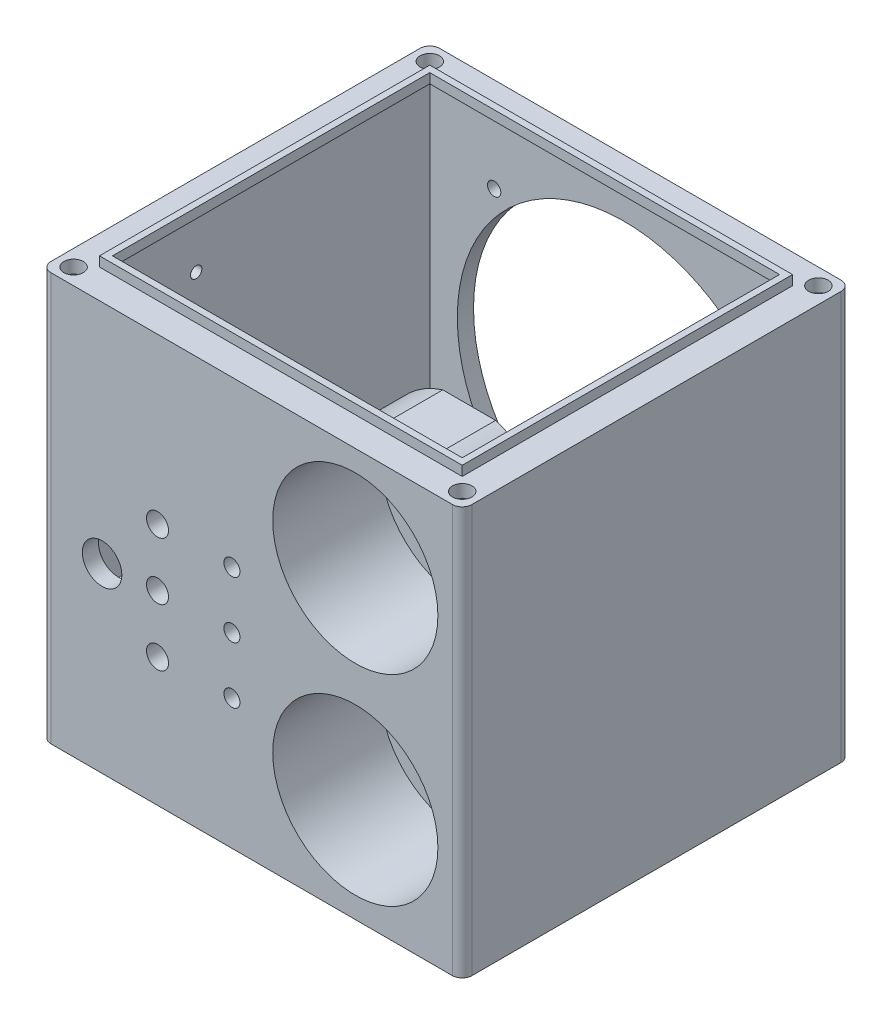
from build123d import *

# Parameters (mm, degrees)
SKETCH1_W           = 130
SKETCH1_H           = 126
BOSS_EXTRUDE1_DEPTH = 120
SKETCH3_W           = 120
SKETCH3_H           = 110
CUT_EXTRUDE3_DEPTH  = 121
SKETCH2_R           = 11
SKETCH2_R_2         = 3.55
SKETCH2_R_3         = 6.1
SKETCH2_R_4         = 3.4
SKETCH2_R_5         = 2.476
CUT_EXTRUDE4_DEPTH  = 5
SKETCH6_R           = 51.5
SKETCH6_R_2         = 2.05
CUT_EXTRUDE5_DEPTH  = 5
SKETCH7_W           = 120
SKETCH7_H           = 110
SKETCH7_W_2         = 108
SKETCH7_H_2         = 98
BOSS_EXTRUDE2_DEPTH = 6
SKETCH8_W           = 112
SKETCH8_H           = 102
SKETCH8_W_2         = 108
SKETCH8_H_2         = 98
BOSS_EXTRUDE3_DEPTH = 3
SKETCH9_R           = 3
CUT_EXTRUDE6_DEPTH  = 4
CHAMFER2_SIZE       = 6
SKETCH10_R          = 1.75
SKETCH10_W          = 32.45
SKETCH10_H          = 20.574
CUT_EXTRUDE10_DEPTH = 10
FILLET4_R           = 3
SKETCH16_R          = 25.5
CUT_EXTRUDE9_DEPTH  = 2
SKETCH18_R          = 27.25
SKETCH18_R_2        = 25.25
BOSS_EXTRUDE4_DEPTH = 28.16
SKETCH19_R          = 27.25
BOSS_EXTRUDE5_DEPTH = 2
SKETCH20_R          = 3.55
SKETCH20_R_2        = 11
CUT_EXTRUDE11_DEPTH = 51
SKETCH21_R          = 25.5
CUT_EXTRUDE12_DEPTH = 31.16


with BuildPart() as part:
    # Sketch1 → Boss-Extrude1 (new body)
    with BuildSketch(Plane.XY):
        Rectangle(SKETCH1_W, SKETCH1_H)
    extrude(amount=BOSS_EXTRUDE1_DEPTH)

    # Sketch3 → Cut-Extrude3 (cut)
    with BuildSketch(Plane(origin=(0, 63, 0), x_dir=(1, 0, 0), z_dir=(0, 1, 0))):
        with Locations((0, -60)):
            Rectangle(SKETCH3_W, SKETCH3_H)
    extrude(amount=-CUT_EXTRUDE3_DEPTH, mode=Mode.SUBTRACT)

    # Sketch2 → Cut-Extrude4 (cut)
    with BuildSketch(Plane.XY.offset(120)):
        with Locations((32, 31)):
            Circle(SKETCH2_R)
        with Locations((32, 49.7)):
            Circle(SKETCH2_R_2)
        with Locations((-46.2, -6.9)):
            Circle(SKETCH2_R_3)
        with Locations((-29.08, -5.56)):
            Circle(SKETCH2_R_4)
        with Locations((-29.08, 12.19)):
            Circle(SKETCH2_R_4)
        with Locations((-29.08, -23.31)):
            Circle(SKETCH2_R_4)
        with Locations((-6.1, -22.81)):
            Circle(SKETCH2_R_5)
        with Locations((-6.1, -5.31)):
            Circle(SKETCH2_R_5)
        with Locations((-6.1, 12.19)):
            Circle(SKETCH2_R_5)
        with Locations((32, -49.7)):
            Circle(SKETCH2_R_2)
        with Locations((32, 12.3)):
            Circle(SKETCH2_R_2)
        with Locations((32, -31)):
            Circle(SKETCH2_R)
        with Locations((32, -12.3)):
            Circle(SKETCH2_R_2)
    extrude(amount=-CUT_EXTRUDE4_DEPTH, mode=Mode.SUBTRACT)

    # Sketch6 → Cut-Extrude5 (cut)
    with BuildSketch(Plane(origin=(0, 0, 0), x_dir=(-1, 0, 0), z_dir=(0, 0, -1))):
        with Locations((0, -1.25)):
            Circle(SKETCH6_R)
        with Locations((40.128309832, -41.378309832)):
            Circle(SKETCH6_R_2)
        with Locations((-40.128309832, -41.378309832)):
            Circle(SKETCH6_R_2)
        with Locations((40.128309832, 38.878309832)):
            Circle(SKETCH6_R_2)
        with Locations((-40.128309832, 38.878309832)):
            Circle(SKETCH6_R_2)
    extrude(amount=-CUT_EXTRUDE5_DEPTH, mode=Mode.SUBTRACT)

    # Sketch7 → Boss-Extrude2 (add)
    with BuildSketch(Plane(origin=(0, 63, 0), x_dir=(1, 0, 0), z_dir=(0, 1, 0))):
        with Locations((0, -60)):
            Rectangle(SKETCH7_W, SKETCH7_H)
        with Locations((0, -60)):
            Rectangle(SKETCH7_W_2, SKETCH7_H_2, mode=Mode.SUBTRACT)
    extrude(amount=-BOSS_EXTRUDE2_DEPTH)

    # Sketch8 → Boss-Extrude3 (add)
    with BuildSketch(Plane(origin=(0, 63, 0), x_dir=(1, 0, 0), z_dir=(0, 1, 0))):
        with Locations((0, -60)):
            Rectangle(SKETCH8_W, SKETCH8_H)
        with Locations((0, -60)):
            Rectangle(SKETCH8_W_2, SKETCH8_H_2, mode=Mode.SUBTRACT)
    extrude(amount=BOSS_EXTRUDE3_DEPTH)

    # Sketch9 → Cut-Extrude6 (cut)
    with BuildSketch(Plane(origin=(0, 63, 0), x_dir=(1, 0, 0), z_dir=(0, 1, 0))):
        with Locations(Location((-60, -5, 0), (0, 0, 180))):
            Circle(SKETCH9_R)
        with Locations(Location((-60, -115, 0), (0, 0, 180))):
            Circle(SKETCH9_R)
        with Locations(Location((60, -115, 0), (0, 0, 180))):
            Circle(SKETCH9_R)
        with Locations(Location((60, -5, 0), (0, 0, 180))):
            Circle(SKETCH9_R)
    extrude(amount=-CUT_EXTRUDE6_DEPTH, mode=Mode.SUBTRACT)

    # Chamfer2
    chamfer2_edges = [part.edges().sort_by_distance(p)[0] for p in [
        (0, 57, 11),
        (-54, 57, 60),
        (0, 57, 109),
        (54, 57, 60),
    ]]
    chamfer(chamfer2_edges, length=CHAMFER2_SIZE - 0.0001)  # a hair under: the kernel refuses the full size

    # Sketch10 → Cut-Extrude10 (cut)
    with BuildSketch(Plane.ZY.offset(65)):
        with Locations((63.241, -24.894)):
            Circle(SKETCH10_R)
        with Locations((108.25, -24.894)):
            Circle(SKETCH10_R)
        with Locations((108.25, -49.597)):
            Circle(SKETCH10_R)
        with Locations((63.241, -49.597)):
            Circle(SKETCH10_R)
        with Locations((77.14, 42.7)):
            Circle(SKETCH10_R)
        with Locations((108.25, 42.7)):
            Circle(SKETCH10_R)
        with Locations((108.25, 19.53)):
            Circle(SKETCH10_R)
        with Locations((77.14, 19.53)):
            Circle(SKETCH10_R)
        with Locations((85.7455, -37.2455)):
            Rectangle(SKETCH10_W, SKETCH10_H)
        Polygon((86.345, 24.215), (83.195, 24.215), (83.195, 38.015), (102.195, 38.015), (102.195, 24.215), (99.045, 24.215), (99.045, 21.215), (86.345, 21.215), align=None)
    extrude(amount=-CUT_EXTRUDE10_DEPTH, mode=Mode.SUBTRACT)

    # Fillet4
    fillet4_edges = [part.edges().sort_by_distance(p)[0] for p in [
        (65, 0, 120),
        (-65, 0, 120),
        (65, 0, 0),
        (-65, 0, 0),
    ]]
    fillet(fillet4_edges, radius=FILLET4_R)

    # Sketch16 → Cut-Extrude9 (cut)
    with BuildSketch(Plane.XY.offset(120)):
        with Locations((32, 31)):
            Circle(SKETCH16_R)
        with Locations((32, -31)):
            Circle(SKETCH16_R)
    extrude(amount=-CUT_EXTRUDE9_DEPTH, mode=Mode.SUBTRACT)

    # Sketch18 → Boss-Extrude4 (add)
    # profile 1 of 2: a face of its own
    with BuildSketch(Plane(origin=(0, 0, 115), x_dir=(-1, 0, 0), z_dir=(0, 0, -1))):
        with Locations((-32, -31)):
            Circle(SKETCH18_R)
        with Locations((-32, -31)):
            Circle(SKETCH18_R_2, mode=Mode.SUBTRACT)
    # profile 2 of 2: a face of its own
    with BuildSketch(Plane(origin=(0, 0, 115), x_dir=(-1, 0, 0), z_dir=(0, 0, -1))):
        with BuildLine():
            Line((-40.158584436, 57), (-23.841415564, 57))
            ThreePointArc((-23.841415564, 57), (-32, 3.75), (-40.158584436, 57))
        make_face()
        with Locations((-32, 31)):
            Circle(SKETCH18_R_2, mode=Mode.SUBTRACT)
    extrude(amount=BOSS_EXTRUDE4_DEPTH)

    # Sketch19 → Boss-Extrude5 (add)
    with BuildSketch(Plane(origin=(0, 0, 86.84), x_dir=(-1, 0, 0), z_dir=(0, 0, -1))):
        with Locations((-32, -31)):
            Circle(SKETCH19_R)
        with BuildLine():
            Line((-40.158584436, 57), (-23.841415564, 57))
            ThreePointArc((-23.841415564, 57), (-32, 3.75), (-40.158584436, 57))
        make_face()
    extrude(amount=BOSS_EXTRUDE5_DEPTH)

    # Sketch20 → Cut-Extrude11 (cut)
    with BuildSketch(Plane.XY.offset(118)):
        with Locations((32, 49.7)):
            Circle(SKETCH20_R)
        with Locations((32, 31)):
            Circle(SKETCH20_R_2)
        with Locations((32, 12.3)):
            Circle(SKETCH20_R)
        with Locations((32, -31)):
            Circle(SKETCH20_R_2)
        with Locations((32, -12.3)):
            Circle(SKETCH20_R)
        with Locations((32, -49.7)):
            Circle(SKETCH20_R)
    extrude(amount=-CUT_EXTRUDE11_DEPTH, mode=Mode.SUBTRACT)

    # Sketch21 → Cut-Extrude12 (cut)
    with BuildSketch(Plane.XY.offset(118)):
        with Locations((32, 31)):
            Circle(SKETCH21_R)
        with Locations((32, -31)):
            Circle(SKETCH21_R)
    extrude(amount=-CUT_EXTRUDE12_DEPTH, mode=Mode.SUBTRACT)


solid = part.part
